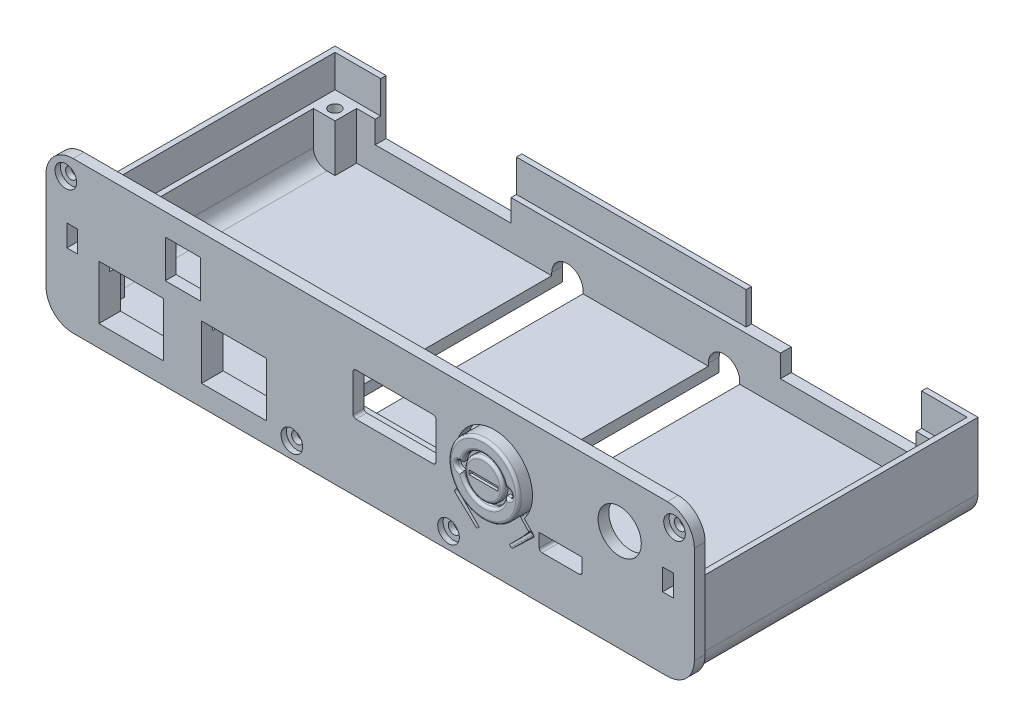
from build123d import *
from OCP.BRepAlgoAPI import BRepAlgoAPI_Cut
from OCP.TopTools import TopTools_ListOfShape
from build123d.topology import SkipClean

# Parameters (mm, degrees)
SKETCH4_R           = 1.05
BOSS_EXTRUDE1_DEPTH = 2
BOSS_EXTRUDE2_DEPTH = 51
SHELL1_T            = -2
SKETCH6_W           = 117
SKETCH6_H           = 49
SKETCH6_W_2         = 115
SKETCH6_H_2         = 47
CUT_EXTRUDE1_DEPTH  = 6
SKETCH9_W           = 25.130870457
SKETCH9_H           = 13.428709405
CUT_EXTRUDE2_DEPTH  = 32
SKETCH10_W          = 117
SKETCH10_H          = 1
CUT_EXTRUDE3_DEPTH  = 6
CUT_EXTRUDE7_DEPTH  = 10
CUT_EXTRUDE8_DEPTH  = 10
SKETCH13_R          = 4
CUT_EXTRUDE9_DEPTH  = 10
SKETCH14_W          = 7.352450109
SKETCH14_H          = 6
CUT_EXTRUDE10_DEPTH = 10
SKETCH18_R          = 1.506301258
BOSS_EXTRUDE3_DEPTH = 7.5
CUT_EXTRUDE11_DEPTH = 12
BOSS_EXTRUDE4_START = 2
SKETCH21_R          = 6.49628378
BOSS_EXTRUDE4_DEPTH = 2
SKETCH22_W          = 74.4
SKETCH22_H          = 47
CUT_EXTRUDE12_DEPTH = 10
SKETCH23_W          = 12
SKETCH23_H          = 10
CUT_EXTRUDE13_DEPTH = 10
SKETCH24_W          = 12
SKETCH24_H          = 10
CUT_EXTRUDE14_DEPTH = 10
SKETCH25_W          = 6.513932021
SKETCH25_H          = 7
CUT_EXTRUDE15_DEPTH = 10
SKETCH26_W          = 4
SKETCH26_H          = 4
BOSS_EXTRUDE5_DEPTH = 10
SKETCH27_R          = 1.074653394
SKETCH27_R_2        = 1.10000034
CUT_EXTRUDE16_DEPTH = 5
SKETCH30_R          = 4.063861765
SKETCH30_R_2        = 3.563861765
CUT_EXTRUDE17_DEPTH = 1
SKETCH31_R          = 0.8
CUT_EXTRUDE19_DEPTH = 1
SKETCH33_W          = 5.378134745
SKETCH33_H          = 0.783023449
CUT_EXTRUDE21_DEPTH = 0.5
FILLET1_R           = 0.5
CUT_EXTRUDE27_START = -2
CUT_EXTRUDE27_DEPTH = 3
SKETCH39_W          = 6.775984987
SKETCH39_H          = 2
CUT_EXTRUDE28_DEPTH = 1
CUT_EXTRUDE29_DEPTH = 2
SKETCH41_W          = 2
SKETCH41_H          = 4.855231841
CUT_EXTRUDE30_DEPTH = 1
CUT_EXTRUDE35_DEPTH = 2
CUT_EXTRUDE36_DEPTH = 2
SKETCH47_W          = 2
SKETCH47_H          = 4
CUT_EXTRUDE37_DEPTH = 2
SKETCH48_W          = 2
SKETCH48_H          = 4
CUT_EXTRUDE38_DEPTH = 2
SKETCH49_R          = 2
CUT_EXTRUDE39_DEPTH = 1


with BuildPart() as part:
    # Sketch4 → Boss-Extrude1 (new body)
    with BuildSketch(Plane.XY):
        with BuildLine():
            Line((0, 14.052488348), (-55, 14.052488348))
            ThreePointArc((-55, 14.052488348), (-58.535533906, 12.588022254), (-60, 9.052488348))
            Line((-60, 9.052488348), (-60, -8.947511652))
            ThreePointArc((-60, -8.947511652), (-58.535533906, -12.483045558), (-55, -13.947511652))
            Line((-55, -13.947511652), (0, -13.947511652))
            Line((0, -13.947511652), (55, -13.947511652))
            ThreePointArc((55, -13.947511652), (58.535533906, -12.483045558), (60, -8.947511652))
            Line((60, -8.947511652), (60, 9.052488348))
            ThreePointArc((60, 9.052488348), (58.535533906, 12.588022254), (55, 14.052488348))
            Line((55, 14.052488348), (0, 14.052488348))
        make_face()
        with Locations((-56.327907587, 10.548035553)):
            Circle(SKETCH4_R, mode=Mode.SUBTRACT)
        with Locations((-14.5, -10.947511652)):
            Circle(SKETCH4_R, mode=Mode.SUBTRACT)
        with Locations((14.5, -10.947511652)):
            Circle(SKETCH4_R, mode=Mode.SUBTRACT)
        with Locations((56.327907587, 10.548035553)):
            Circle(SKETCH4_R, mode=Mode.SUBTRACT)
    extrude(amount=BOSS_EXTRUDE1_DEPTH)

    # Sketch11 → Cut-Extrude7 (cut)
    with BuildSketch(Plane.XY.offset(2)):
        with BuildLine():
            Line((-2.648051185, 6.342348657), (11.669171801, 6.342348657))
            ThreePointArc((11.669171801, 6.342348657), (12.022725191, 6.195902047), (12.169171801, 5.842348657))
            Line((12.169171801, 5.842348657), (12.169171801, -1.057651343))
            ThreePointArc((12.169171801, -1.057651343), (12.022725191, -1.411204734), (11.669171801, -1.557651343))
            Line((11.669171801, -1.557651343), (-2.648051185, -1.557651343))
            ThreePointArc((-2.648051185, -1.557651343), (-3.001604575, -1.411204734), (-3.148051185, -1.057651343))
            Line((-3.148051185, -1.057651343), (-3.148051185, 5.842348657))
            ThreePointArc((-3.148051185, 5.842348657), (-3.001604575, 6.195902047), (-2.648051185, 6.342348657))
        make_face()
    extrude(amount=-CUT_EXTRUDE7_DEPTH, mode=Mode.SUBTRACT)


with BuildPart() as body_2:
    # Sketch5 → Boss-Extrude2 (new body)
    with BuildSketch(Plane.XY):
        with BuildLine():
            Line((17.4, -10.947511652), (17.4, -13.447511652))
            Line((17.4, -13.447511652), (55, -13.447511652))
            ThreePointArc((55, -13.447511652), (58.181980515, -12.129492167), (59.5, -8.947511652))
            Line((59.5, -8.947511652), (59.5, 3.319668657))
            Line((59.5, 3.319668657), (-59.5, 3.319668657))
            Line((-59.5, 3.319668657), (-59.5, -8.947511652))
            ThreePointArc((-59.5, -8.947511652), (-58.181980515, -12.129492167), (-55, -13.447511652))
            Line((-55, -13.447511652), (-17.4, -13.447511652))
            Line((-17.4, -13.447511652), (-17.4, -10.947511652))
            ThreePointArc((-17.4, -10.947511652), (-14.5, -8.047511652), (-11.6, -10.947511652))
            Line((-11.6, -10.947511652), (-11.6, -13.447511652))
            Line((-11.6, -13.447511652), (0, -13.447511652))
            Line((0, -13.447511652), (11.6, -13.447511652))
            Line((11.6, -13.447511652), (11.6, -10.947511652))
            ThreePointArc((11.6, -10.947511652), (14.5, -8.047511652), (17.4, -10.947511652))
        make_face()
    extrude(amount=-BOSS_EXTRUDE2_DEPTH)

    # Shell1
    shell1_openings = [body_2.faces().sort_by_distance(p)[0] for p in [
        (0, 3.319668657, -25.5),
    ]]
    offset(amount=SHELL1_T, openings=shell1_openings, kind=Kind.INTERSECTION)

    # Sketch6 → Cut-Extrude1 (cut)
    with BuildSketch(Plane(origin=(0, 3.319668657, 0), x_dir=(1, 0, 0), z_dir=(0, 1, 0))):
        with Locations((0, 25.5)):
            Rectangle(SKETCH6_W, SKETCH6_H)
        with Locations((0, 25.5)):
            Rectangle(SKETCH6_W_2, SKETCH6_H_2, mode=Mode.SUBTRACT)
    extrude(amount=-CUT_EXTRUDE1_DEPTH, mode=Mode.SUBTRACT)

    # Sketch9 → Cut-Extrude2 (cut)
    with BuildSketch(Plane(origin=(0, 0, -51), x_dir=(-1, 0, 0), z_dir=(0, 0, -1))):
        with Locations((37.49553302, -0.076115147)):
            Rectangle(SKETCH9_W, SKETCH9_H)
        with Locations((-37.504466981, -0.076115147)):
            Rectangle(SKETCH9_W, SKETCH9_H)
    extrude(amount=-CUT_EXTRUDE2_DEPTH, mode=Mode.SUBTRACT)

    # Sketch10 → Cut-Extrude3 (cut)
    with BuildSketch(Plane(origin=(0, 3.319668657, 0), x_dir=(1, 0, 0), z_dir=(0, 1, 0))):
        with Locations((0, 0.5)):
            Rectangle(SKETCH10_W, SKETCH10_H)
    extrude(amount=-CUT_EXTRUDE3_DEPTH, mode=Mode.SUBTRACT)


with BuildPart() as cut_extrude8_tool:
    # Sketch12 → Cut-Extrude8 (new body)
    with BuildSketch(Plane.XY.offset(2)):
        with BuildLine():
            Line((31.788883699, -5.740491065), (38.700111452, -5.740491065))
            ThreePointArc((38.700111452, -5.740491065), (39.053664842, -5.594044456), (39.200111452, -5.240491065))
            Line((39.200111452, -5.240491065), (39.200111452, -2.740491065))
            Line((39.200111452, -2.740491065), (31.288883699, -2.740491065))
            Line((31.288883699, -2.740491065), (31.288883699, -5.240491065))
            ThreePointArc((31.288883699, -5.240491065), (31.435330308, -5.594044456), (31.788883699, -5.740491065))
        make_face()
    extrude(amount=-CUT_EXTRUDE8_DEPTH)


with BuildPart() as part_1:
    add(part.part)

    # Cut-Extrude8: cut by cut_extrude8_tool
    add(cut_extrude8_tool.part, mode=Mode.SUBTRACT)

    # Sketch13 → Cut-Extrude9 (cut)
    with BuildSketch(Plane.XY.offset(2)):
        with Locations((46.180246868, 4.878767266)):
            Circle(SKETCH13_R)
    extrude(amount=-CUT_EXTRUDE9_DEPTH, mode=Mode.SUBTRACT)



with BuildPart() as body_2_1:
    add(body_2.part)

    # Cut-Extrude8: cut by cut_extrude8_tool
    add(cut_extrude8_tool.part, mode=Mode.SUBTRACT)

    # Sketch14 → Cut-Extrude10 (cut)
    with BuildSketch(Plane(origin=(0, 0, -51), x_dir=(-1, 0, 0), z_dir=(0, 0, -1))):
        with Locations((-21.262806698, 0.319668657)):
            Rectangle(SKETCH14_W, SKETCH14_H)
    extrude(amount=-CUT_EXTRUDE10_DEPTH, mode=Mode.SUBTRACT)


with BuildPart() as part_2:
    add(part_1.part)

    add(body_2_1.part)  # Boss-Extrude3 merges body 2
    # Sketch18 → Boss-Extrude3 (add)
    with BuildSketch(Plane.XY.offset(2)):
        with Locations((23.000084123, 2.452346501)):
            Circle(SKETCH18_R)
    extrude(amount=-BOSS_EXTRUDE3_DEPTH)

    # Sketch19 → Cut-Extrude11 (cut)
    with BuildSketch(Plane.XY.offset(2)):
        with BuildLine():
            ThreePointArc((28.638787024, -1.752520746), (22.972397633, 9.561862347), (17.306008242, -1.752520746))
            ThreePointArc((17.306008242, -1.752520746), (17.345508482, -1.884035517), (17.290888803, -2.010023987))
            Line((17.290888803, -2.010023987), (15.648432022, -3.739845491))
            ThreePointArc((15.648432022, -3.739845491), (15.593535563, -3.882736485), (15.655757096, -4.022593335))
            Line((15.655757096, -4.022593335), (16.253683927, -4.590321841))
            Line((16.253683927, -4.590321841), (19.587324101, -7.75559635))
            ThreePointArc((19.587324101, -7.75559635), (19.724621598, -7.810559463), (19.862145405, -7.756165077))
            Line((19.862145405, -7.756165077), (20.183450987, -7.453605922))
            Line((20.183450987, -7.453605922), (17.5592003, -4.780081513))
            Line((17.5592003, -4.780081513), (16.711326566, -3.787896942))
            ThreePointArc((16.711326566, -3.787896942), (16.663388195, -3.655446953), (16.71464739, -3.524246413))
            Line((16.71464739, -3.524246413), (17.5592003, -2.584920967))
            Line((17.5592003, -2.584920967), (18.057932515, -2.030222909))
            ThreePointArc((18.057932515, -2.030222909), (18.109198654, -1.898392171), (18.060431452, -1.76561672))
            ThreePointArc((18.060431452, -1.76561672), (22.972397633, 8.982054033), (27.884363814, -1.76561672))
            ThreePointArc((27.884363814, -1.76561672), (27.835596611, -1.898392171), (27.886862751, -2.030222909))
            Line((27.886862751, -2.030222909), (28.385594965, -2.584920967))
            Line((28.385594965, -2.584920967), (29.230147876, -3.524246413))
            ThreePointArc((29.230147876, -3.524246413), (29.28140707, -3.655446953), (29.233468699, -3.787896942))
            Line((29.233468699, -3.787896942), (28.385594965, -4.780081513))
            Line((28.385594965, -4.780081513), (25.761344279, -7.453605922))
            Line((25.761344279, -7.453605922), (26.082649861, -7.756165077))
            ThreePointArc((26.082649861, -7.756165077), (26.220173667, -7.810559463), (26.357471165, -7.75559635))
            Line((26.357471165, -7.75559635), (29.691111338, -4.590321841))
            Line((29.691111338, -4.590321841), (30.28903817, -4.022593335))
            ThreePointArc((30.28903817, -4.022593335), (30.351259703, -3.882736485), (30.296363244, -3.739845491))
            Line((30.296363244, -3.739845491), (28.653906462, -2.010023987))
            ThreePointArc((28.653906462, -2.010023987), (28.599286783, -1.884035517), (28.638787024, -1.752520746))
        make_face()
    extrude(amount=-CUT_EXTRUDE11_DEPTH, mode=Mode.SUBTRACT)

    # Sketch21 → Boss-Extrude4 (add)
    with SkipClean():  # the faces are left unmerged after this step: merging them gives an invalid solid
        with BuildSketch(Plane.XY.offset(2).offset(BOSS_EXTRUDE4_START)):
            with Locations((22.972397633, 2.485770253)):
                Circle(SKETCH21_R)
        extrude(amount=-BOSS_EXTRUDE4_DEPTH)

    # Sketch22 → Cut-Extrude12 (cut)
    with SkipClean():  # the faces are left unmerged after this step: merging them gives an invalid solid
        with BuildSketch(Plane(origin=(0, -11.447511652, 0), x_dir=(1, 0, 0), z_dir=(0, 1, 0))):
            with Locations((0, 25.5)):
                Rectangle(SKETCH22_W, SKETCH22_H)
        extrude(amount=CUT_EXTRUDE12_DEPTH, mode=Mode.SUBTRACT)

    # Sketch23 → Cut-Extrude13 (cut)
    with SkipClean():  # the faces are left unmerged after this step: merging them gives an invalid solid
        with BuildSketch(Plane.XY.offset(2)):
            with Locations((-44.208989631, -5.020837745)):
                Rectangle(SKETCH23_W, SKETCH23_H)
        extrude(amount=-CUT_EXTRUDE13_DEPTH, mode=Mode.SUBTRACT)

    # Sketch24 → Cut-Extrude14 (cut)
    with SkipClean():  # the faces are left unmerged after this step: merging them gives an invalid solid
        with BuildSketch(Plane.XY.offset(2)):
            with Locations((-25.208989631, -5.099208322)):
                Rectangle(SKETCH24_W, SKETCH24_H)
        extrude(amount=-CUT_EXTRUDE14_DEPTH, mode=Mode.SUBTRACT)

    # Sketch25 → Cut-Extrude15 (cut)
    with SkipClean():  # the faces are left unmerged after this step: merging them gives an invalid solid
        with BuildSketch(Plane.XY.offset(2)):
            with Locations((-34.665339368, 6.487243275)):
                Rectangle(SKETCH25_W, SKETCH25_H)
        extrude(amount=-CUT_EXTRUDE15_DEPTH, mode=Mode.SUBTRACT)

    # Sketch26 → Boss-Extrude5 (add)
    with SkipClean():  # the faces are left unmerged after this step: merging them gives an invalid solid
        with BuildSketch(Plane(origin=(0, -2.680331343, 0), x_dir=(1, 0, 0), z_dir=(0, 1, 0))):
            with Locations((-55.5, 47)):
                Rectangle(SKETCH26_W, SKETCH26_H)
            with Locations((-55.5, 4)):
                Rectangle(SKETCH26_W, SKETCH26_H)
            with Locations((55.5, 4)):
                Rectangle(SKETCH26_W, SKETCH26_H)
        extrude(amount=-BOSS_EXTRUDE5_DEPTH)

    # Sketch27 → Cut-Extrude16 (cut)
    with SkipClean():  # the faces are left unmerged after this step: merging them gives an invalid solid
        with BuildSketch(Plane(origin=(0, -2.680331343, 0), x_dir=(1, 0, 0), z_dir=(0, 1, 0))):
            with Locations(Location((-55.504845065, 46.975121233, 0), (0, 0, 270))):
                Circle(SKETCH27_R)
            with Locations(Location((55.50000092, 3.00000002, 0), (0, 0, 270))):
                Circle(SKETCH27_R_2)
            with Locations(Location((-55.504845065, 4.024878767, 0), (0, 0, 90))):
                Circle(SKETCH27_R)
        extrude(amount=-CUT_EXTRUDE16_DEPTH, mode=Mode.SUBTRACT)

    # Sketch30 → Cut-Extrude17 (cut)
    with SkipClean():  # the faces are left unmerged after this step: merging them gives an invalid solid
        with BuildSketch(Plane.XY.offset(4)):
            with Locations((22.972397633, 2.485770253)):
                Circle(SKETCH30_R)
            with Locations((22.972397633, 2.485770253)):
                Circle(SKETCH30_R_2, mode=Mode.SUBTRACT)
        extrude(amount=-CUT_EXTRUDE17_DEPTH, mode=Mode.SUBTRACT)

    # Sketch31 → Cut-Extrude19 (cut)
    with SkipClean():  # the faces are left unmerged after this step: merging them gives an invalid solid
        with BuildSketch(Plane.XY.offset(4)):
            with Locations((27.336251454, 2.494096789)):
                Circle(SKETCH31_R)
            with Locations((18.60854243, 2.493338462)):
                Circle(SKETCH31_R)
        extrude(amount=-CUT_EXTRUDE19_DEPTH, mode=Mode.SUBTRACT)

    # Sketch33 → Cut-Extrude21 (cut)
    with SkipClean():  # the faces are left unmerged after this step: merging them gives an invalid solid
        with BuildSketch(Plane.XY.offset(4)):
            with Locations((23.001420671, 2.417404005)):
                Rectangle(SKETCH33_W, SKETCH33_H)
        extrude(amount=-CUT_EXTRUDE21_DEPTH, mode=Mode.SUBTRACT)

    # Fillet1
    fillet1_edges = [part_2.edges().sort_by_distance(p)[0] for p in [
        (16.476113853, 2.485770253, 4),
        (22.972044535, 6.549632003, 4),
        (27.753683045, 3.176556214, 4),
        (22.97275073, -1.578091497, 4),
        (17.808543633, 2.494725896, 4),
    ]]
    fillet(fillet1_edges, radius=FILLET1_R)


with BuildPart() as cut_extrude27_tool:
    # Cut-Extrude27: read off the stored shape, not the designer's step
    # Cut-Extrude27 outline → Cut-Extrude27 (new body)
    with BuildSketch(Plane(origin=(0, 0, -2), x_dir=(-1, 0, 0), z_dir=(0, 0, -1)).offset(CUT_EXTRUDE27_START)):
        Polygon((-28.471378983, -2.680331343), (-28.850763429, -3.102288878), (-17.17447672, -3.012816774), (-17.473416283, -2.680331344), align=None)
    extrude(amount=CUT_EXTRUDE27_DEPTH)


with BuildPart() as part_3:
    add(part_2.part)

    # Cut-Extrude27: cut by cut_extrude27_tool, with a tolerance
    cut_extrude27_stock = TopTools_ListOfShape()
    cut_extrude27_stock.Append(part_3.part.wrapped)
    cut_extrude27_tools = TopTools_ListOfShape()
    cut_extrude27_tools.Append(cut_extrude27_tool.part.wrapped)
    cut_extrude27_cut = BRepAlgoAPI_Cut()
    cut_extrude27_cut.SetArguments(cut_extrude27_stock)
    cut_extrude27_cut.SetTools(cut_extrude27_tools)
    cut_extrude27_cut.SetFuzzyValue(0.00001)
    cut_extrude27_cut.Build()
    add(Compound.cast(cut_extrude27_cut.Shape()).solids(), mode=Mode.REPLACE)


with BuildPart() as cut_extrude27_2_tool:
    # Cut-Extrude27 2 outline → Cut-Extrude27 2 (revolve)
    with BuildSketch(Plane(origin=(22.972397633, 2.485770253, 0), x_dir=(1, 0, 0), z_dir=(0, -1, 0))):
        with BuildLine():
            ThreePointArc((3.063861765, 4), (3.417415156, 3.853553391), (3.563861765, 3.5))
            Line((3.563861765, 3.5), (3.563861765, 4))
            Line((3.563861765, 4), (3.063861765, 4))
        make_face()
    revolve(axis=Axis((22.972397633, 2.485770253, 0), (0, 0, 1)))


with BuildPart() as part_4:
    add(part_3.part)

    # Cut-Extrude27 2: cut by cut_extrude27_2_tool, with a tolerance
    cut_extrude27_2_stock = TopTools_ListOfShape()
    cut_extrude27_2_stock.Append(part_4.part.wrapped)
    cut_extrude27_2_tools = TopTools_ListOfShape()
    cut_extrude27_2_tools.Append(cut_extrude27_2_tool.part.wrapped)
    cut_extrude27_2_cut = BRepAlgoAPI_Cut()
    cut_extrude27_2_cut.SetArguments(cut_extrude27_2_stock)
    cut_extrude27_2_cut.SetTools(cut_extrude27_2_tools)
    cut_extrude27_2_cut.SetFuzzyValue(0.00001)
    cut_extrude27_2_cut.Build()
    add(Compound.cast(cut_extrude27_2_cut.Shape()).solids(), mode=Mode.REPLACE)

    # Sketch39 → Cut-Extrude28 (cut)
    with SkipClean():  # the faces are left unmerged after this step: merging them gives an invalid solid
        with BuildSketch(Plane(origin=(-0.022076634, -2.881044418, 0), x_dir=(0.9999706426615632, -0.007662494047001038, 0), z_dir=(0.007662494047001038, 0.9999706426615632, 0))):
            with Locations((22.952676025, 1)):
                Rectangle(SKETCH39_W, SKETCH39_H)
        extrude(amount=-CUT_EXTRUDE28_DEPTH, mode=Mode.SUBTRACT)

    # Sketch40 → Cut-Extrude29 (cut)
    with SkipClean():  # the faces are left unmerged after this step: merging them gives an invalid solid
        with BuildSketch(Plane(origin=(0, 0, -2), x_dir=(-1, 0, 0), z_dir=(0, 0, -1))):
            Polygon((-19.222309799, -3.028508743), (-17.17447672, -3.012816774), (-20.531053303, -6.520903127), (-24.79896346, -6.520903127), (-28.850763429, -3.102288878), align=None)
        extrude(amount=-CUT_EXTRUDE29_DEPTH, mode=Mode.SUBTRACT)

    # Sketch41 → Cut-Extrude30 (cut)
    with SkipClean():  # the faces are left unmerged after this step: merging them gives an invalid solid
        with BuildSketch(Plane(origin=(7.461169685, 7.138931295, 0), x_dir=(0, 0, -1), z_dir=(0.7225373511431777, 0.6913318857126441, 0))):
            with Locations((1, -16.477751948)):
                Rectangle(SKETCH41_W, SKETCH41_H)
        extrude(amount=-CUT_EXTRUDE30_DEPTH, mode=Mode.SUBTRACT)

    # Sketch45 → Cut-Extrude35 (cut)
    with SkipClean():  # the faces are left unmerged after this step: merging them gives an invalid solid
        with BuildSketch(Plane(origin=(0, 0, -2), x_dir=(-1, 0, 0), z_dir=(0, 0, -1))):
            Polygon((-20.183450987, -7.453605922), (-20.531053303, -6.520903127), (-19.879686687, -7.144138052), align=None)
        extrude(amount=-CUT_EXTRUDE35_DEPTH, mode=Mode.SUBTRACT)

    # Sketch46 → Cut-Extrude36 (cut)
    with SkipClean():  # the faces are left unmerged after this step: merging them gives an invalid solid
        with BuildSketch(Plane(origin=(0, 0, -2), x_dir=(-1, 0, 0), z_dir=(0, 0, -1))):
            Polygon((-25.761344279, -7.453605922), (-24.79896346, -6.520903127), (-28.926635132, -3.038273852), (-29.489441573, -3.705321654), align=None)
        extrude(amount=-CUT_EXTRUDE36_DEPTH, mode=Mode.SUBTRACT)

    # Sketch47 → Cut-Extrude37 (cut)
    with SkipClean():  # the faces are left unmerged after this step: merging them gives an invalid solid
        with BuildSketch(Plane.XY.offset(2)):
            with Locations((55.128215007, 1.148016517)):
                Rectangle(SKETCH47_W, SKETCH47_H)
        extrude(amount=-CUT_EXTRUDE37_DEPTH, mode=Mode.SUBTRACT)

    # Sketch48 → Cut-Extrude38 (cut)
    with SkipClean():  # the faces are left unmerged after this step: merging them gives an invalid solid
        with BuildSketch(Plane.XY.offset(2)):
            with Locations((-55.13, 1.148016517)):
                Rectangle(SKETCH48_W, SKETCH48_H)
        extrude(amount=-CUT_EXTRUDE38_DEPTH, mode=Mode.SUBTRACT)

    # Sketch49 → Cut-Extrude39 (cut)
    with SkipClean():  # the faces are left unmerged after this step: merging them gives an invalid solid
        with BuildSketch(Plane.XY.offset(2)):
            with Locations((-56.327907587, 10.548035553)):
                Circle(SKETCH49_R)
            with Locations((-14.5, -10.947511652)):
                Circle(SKETCH49_R)
            with Locations((14.5, -10.947511652)):
                Circle(SKETCH49_R)
            with Locations((56.327907587, 10.548035553)):
                Circle(SKETCH49_R)
        extrude(amount=-CUT_EXTRUDE39_DEPTH, mode=Mode.SUBTRACT)


solid = part_4.part
